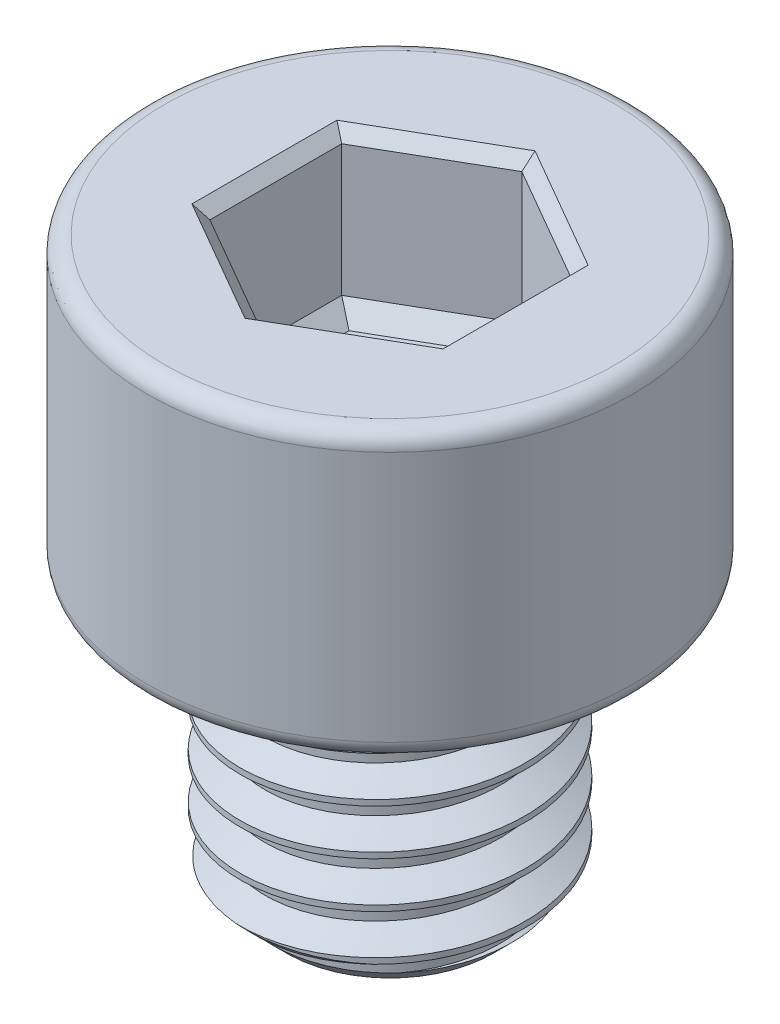
from build123d import *

# Parameters (mm, degrees)
SKETCH1_R           = 2.5
BOSS_EXTRUDE1_DEPTH = 5
THREAD1_PITCH       = 0.8
SKETCH5_R           = 4.25
BOSS_EXTRUDE2_DEPTH = 5
FILLET1_R           = 0.3
CUT_EXTRUDE1_DEPTH  = 2.5
CHAMFER1_SIZE       = 0.2
CUT_EXTRUDE2_DEPTH  = 0.3
CUT_EXTRUDE2_DRAFT  = -45


with BuildPart() as part:
    # Sketch1 → Boss-Extrude1 (new body)
    with BuildSketch(Plane(origin=(0, 0, 0), x_dir=(1, 0, 0), z_dir=(0, 1, 0))):
        with Locations(Location((0, 0, 0), (0, 0, 270))):
            Circle(SKETCH1_R)
    extrude(amount=BOSS_EXTRUDE1_DEPTH)

    # Thread1: the profile of Thread Profile1 profile screwed along a right-hand helix of 7.5 turns, 8 arcs to a turn; built about Z, then put on its axis
    thread1_z = Axis((0, 0, 0), (0, 0, 1))
    thread1_corners = [(2.5003, 0, -0.000173205), (2.5003, 0, 0.700173203), (2.0669873, 0, 0.449999999), (2.0669873, 0, 0.249999999)]
    with BuildLine(mode=Mode.PRIVATE) as thread1_profile:
        Line(thread1_corners[0], thread1_corners[1])
        Line(thread1_corners[1], thread1_corners[2])
        Line(thread1_corners[2], thread1_corners[3])
        Line(thread1_corners[3], thread1_corners[0])
    thread1_cap = Face(thread1_profile.wire())
    thread1_turn_angles = [0, 22.5, 45, 67.5, 90, 112.5, 135, 157.5, 180, 202.5, 225, 247.5, 270, 292.5, 315, 337.5, 360]
    thread1_turn_weights = [1, 0.9238795325112867, 1, 0.9238795325112867, 1, 0.9238795325112867, 1, 0.9238795325112867, 1, 0.9238795325112867, 1, 0.9238795325112867, 1, 0.9238795325112867, 1, 0.9238795325112867, 1]
    thread1_turn_rails = [Edge.make_bspline([Vector(p[0], p[1], 0).rotate(thread1_z, thread1_turn_angles[k]) / thread1_turn_weights[k] + Vector(0, 0, p[2] + THREAD1_PITCH * thread1_turn_angles[k] / 360) for k in range(17)], [0, 0, 0, 1, 1, 2, 2, 3, 3, 4, 4, 5, 5, 6, 6, 7, 7, 8, 8, 8], 2, thread1_turn_weights) for p in thread1_corners]
    thread1_turn_sides = [Face.make_surface_from_curves(thread1_turn_rails[p[0]], thread1_turn_rails[p[1]]) for p in [(0, 1), (1, 2), (2, 3), (3, 0)]]
    thread1_last_angles = [2520, 2542.5, 2565, 2587.5, 2610, 2632.5, 2655, 2677.5, 2700]
    thread1_last_weights = [1, 0.9238795325112867, 1, 0.9238795325112867, 1, 0.9238795325112867, 1, 0.9238795325112867, 1]
    thread1_last_rails = [Edge.make_bspline([Vector(p[0], p[1], 0).rotate(thread1_z, thread1_last_angles[k]) / thread1_last_weights[k] + Vector(0, 0, p[2] + THREAD1_PITCH * thread1_last_angles[k] / 360) for k in range(9)], [0, 0, 0, 1, 1, 2, 2, 3, 3, 4, 4, 4], 2, thread1_last_weights) for p in thread1_corners]
    thread1_last_sides = [Face.make_surface_from_curves(thread1_last_rails[p[0]], thread1_last_rails[p[1]]) for p in [(0, 1), (1, 2), (2, 3), (3, 0)]]
    thread1 = Plane(origin=(0, 6, 0), x_dir=(-1, 0, 0), z_dir=(0, -1, 0)) * Solid(Shell([*[p.moved(Location((0, 0, THREAD1_PITCH * i))) for i in range(7) for p in thread1_turn_sides], *thread1_last_sides, thread1_cap, thread1_cap.rotate(thread1_z, 2700).moved(Location((0, 0, THREAD1_PITCH * 2700 / 360)))]))
    add(thread1, mode=Mode.SUBTRACT)

    # Sketch5 → Boss-Extrude2 (add)
    with BuildSketch(Plane(origin=(0, 5, 0), x_dir=(1, 0, 0), z_dir=(0, 1, 0))):
        with Locations(Location((0, 0, 0), (0, 0, 270))):
            Circle(SKETCH5_R)
    extrude(amount=BOSS_EXTRUDE2_DEPTH)

    # Fillet1
    fillet1_edges = [part.edges().sort_by_distance(p)[0] for p in [
        (0, 5, -4.25),
        (0, 10, -4.25),
    ]]
    fillet(fillet1_edges, radius=FILLET1_R)

    # Sketch6 → Cut-Revolve1 (revolve, cut)
    with BuildSketch(Plane.XY, mode=Mode.PRIVATE) as cut_revolve1_sk:
        Polygon((2.51, 0), (2.51, 0.7), (1.81, 0), align=None)
    revolve(cut_revolve1_sk.sketch.rotate(Axis((0, 0, 0), (0, 1, 0)), 265.327167181), axis=Axis((0, 0, 0), (0, 1, 0)), mode=Mode.SUBTRACT)

    # Sketch7 → Cut-Extrude1 (cut)
    with BuildSketch(Plane(origin=(0, 10, 0), x_dir=(1, 0, 0), z_dir=(0, 1, 0))):
        Polygon((0, 2.309401077), (-2, 1.154700538), (-2, -1.154700538), (0, -2.309401077), (2, -1.154700538), (2, 1.154700538), align=None)
    extrude(amount=-CUT_EXTRUDE1_DEPTH, mode=Mode.SUBTRACT)

    # Chamfer1
    chamfer1_edges = [part.edges().sort_by_distance(p)[0] for p in [
        (1, 10, -1.732050808),
        (-1, 10, -1.732050808),
        (-2, 10, 0),
        (-1, 10, 1.732050808),
        (1, 10, 1.732050808),
        (2, 10, 0),
    ]]
    chamfer(chamfer1_edges, length=CHAMFER1_SIZE)


with BuildPart() as cut_extrude2_tool:
    # Sketch8 → Cut-Extrude2 (with draft: the straight prism first)
    with BuildSketch(Plane(origin=(0, 7.5, 0), x_dir=(1, 0, 0), z_dir=(0, 1, 0))):
        Polygon((0, 2.309401077), (-2, 1.154700538), (-2, -1.154700538), (0, -2.309401077), (2, -1.154700538), (2, 1.154700538), align=None)
    extrude(amount=-CUT_EXTRUDE2_DEPTH)
    # Cut-Extrude2: the draft: its side faces are tilted about the plane it starts from
    cut_extrude2_sides = [cut_extrude2_tool.faces().sort_by_distance(p)[0] for p in [
        (-1, 7.35, -1.732050808),
        (-2, 7.35, 0),
        (-1, 7.35, 1.732050808),
        (1, 7.35, 1.732050808),
        (2, 7.35, 0),
        (1, 7.35, -1.732050808),
    ]]
    draft(cut_extrude2_sides, Plane(origin=(0, 7.5, 0), x_dir=(1, 0, 0), z_dir=(0, 1, 0)), CUT_EXTRUDE2_DRAFT)


with BuildPart() as part_1:
    add(part.part)

    # Cut-Extrude2: cut by cut_extrude2_tool
    add(cut_extrude2_tool.part, mode=Mode.SUBTRACT)


solid = part_1.part
